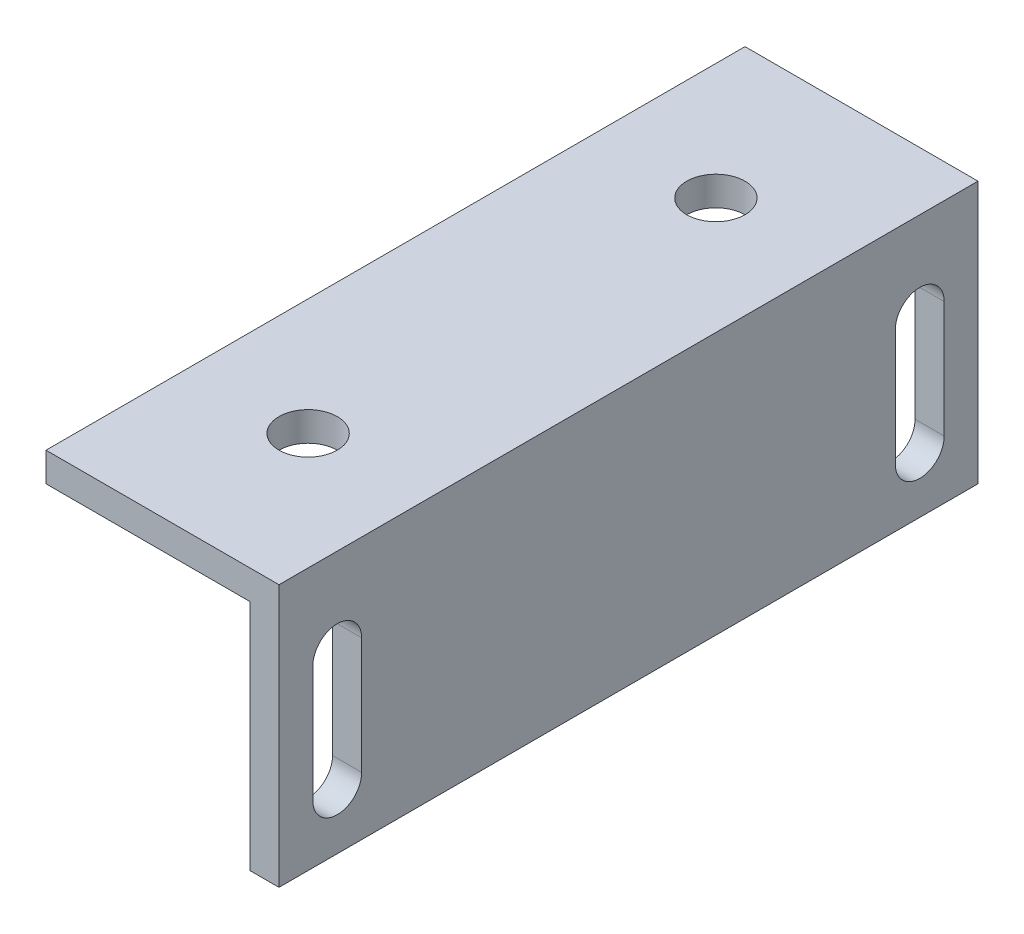
from build123d import *

# Parameters (mm, degrees)
BOSS_EXTRUDE1_DEPTH = 76.2
CUT_EXTRUDE1_REACH  = 97.038
SKETCH2_R           = 3.175
CUT_EXTRUDE2_REACH  = 97.038
SKETCH3_W           = 3.175
SKETCH3_H           = 22.225
CUT_EXTRUDE3_REACH  = 86.362


with BuildPart() as part:
    # Sketch1 → Boss-Extrude1 (new body)
    with BuildSketch(Plane.XY):
        Polygon((0, -50.8), (0, 0), (-25.4, 0), (-25.4, -3.175), (-3.175, -3.175), (-3.175, -50.8), align=None)
    extrude(amount=BOSS_EXTRUDE1_DEPTH)

    # Sketch2 → Cut-Extrude1 (cut, up to next)
    with BuildSketch(Plane(origin=(0, 0, 0), x_dir=(1, 0, 0), z_dir=(0, 1, 0)), mode=Mode.PRIVATE) as cut_extrude1_sk1:
        with Locations((-12.7, -15.875)):
            Circle(SKETCH2_R)
    cut_extrude1_tool1 = extrude(cut_extrude1_sk1.sketch, amount=-CUT_EXTRUDE1_REACH, mode=Mode.PRIVATE) & part.part
    # Sketch2 → Cut-Extrude1 (cut, up to next)
    with BuildSketch(Plane(origin=(0, 0, 0), x_dir=(1, 0, 0), z_dir=(0, 1, 0)), mode=Mode.PRIVATE) as cut_extrude1_sk2:
        with Locations((-12.7, -60.325)):
            Circle(SKETCH2_R)
    cut_extrude1_tool2 = extrude(cut_extrude1_sk2.sketch, amount=-CUT_EXTRUDE1_REACH, mode=Mode.PRIVATE) & part.part
    add(cut_extrude1_tool1.solids().sort_by_distance((-12.7, 0, 15.875))[0], mode=Mode.SUBTRACT)
    add(cut_extrude1_tool2.solids().sort_by_distance((-12.7, 0, 60.325))[0], mode=Mode.SUBTRACT)

    # Sketch3 → Cut-Extrude2 (cut, up to next)
    with BuildSketch(Plane.XY.offset(76.2), mode=Mode.PRIVATE) as cut_extrude2_sk1:
        with Locations((-1.5875, -39.6875)):
            Rectangle(SKETCH3_W, SKETCH3_H)
    cut_extrude2_tool1 = extrude(cut_extrude2_sk1.sketch, amount=-CUT_EXTRUDE2_REACH, mode=Mode.PRIVATE) & part.part
    add(cut_extrude2_tool1.solids().sort_by_distance((-1.5875, -39.6875, 76.2))[0], mode=Mode.SUBTRACT)

    # Sketch4 → Cut-Extrude3 (cut, up to next)
    with BuildSketch(Plane.ZY.offset(3.175), mode=Mode.PRIVATE) as cut_extrude3_sk1:
        with BuildLine():
            Line((72.515, -9.525), (72.515, -22.225))
            ThreePointArc((72.515, -22.225), (69.85, -24.89), (67.185, -22.225))
            Line((67.185, -22.225), (67.185, -9.525))
            ThreePointArc((67.185, -9.525), (69.85, -6.86), (72.515, -9.525))
        make_face()
    cut_extrude3_tool1 = extrude(cut_extrude3_sk1.sketch, amount=-CUT_EXTRUDE3_REACH, mode=Mode.PRIVATE) & part.part
    # Sketch4 → Cut-Extrude3 (cut, up to next)
    with BuildSketch(Plane.ZY.offset(3.175), mode=Mode.PRIVATE) as cut_extrude3_sk2:
        with BuildLine():
            Line((3.685, -9.525), (3.685, -22.225))
            ThreePointArc((3.685, -22.225), (6.35, -24.89), (9.015, -22.225))
            Line((9.015, -22.225), (9.015, -9.525))
            ThreePointArc((9.015, -9.525), (6.35, -6.86), (3.685, -9.525))
        make_face()
    cut_extrude3_tool2 = extrude(cut_extrude3_sk2.sketch, amount=-CUT_EXTRUDE3_REACH, mode=Mode.PRIVATE) & part.part
    add(cut_extrude3_tool1.solids().sort_by_distance((-3.175, -15.875, 69.85))[0], mode=Mode.SUBTRACT)
    add(cut_extrude3_tool2.solids().sort_by_distance((-3.175, -15.875, 6.35))[0], mode=Mode.SUBTRACT)


solid = part.part
